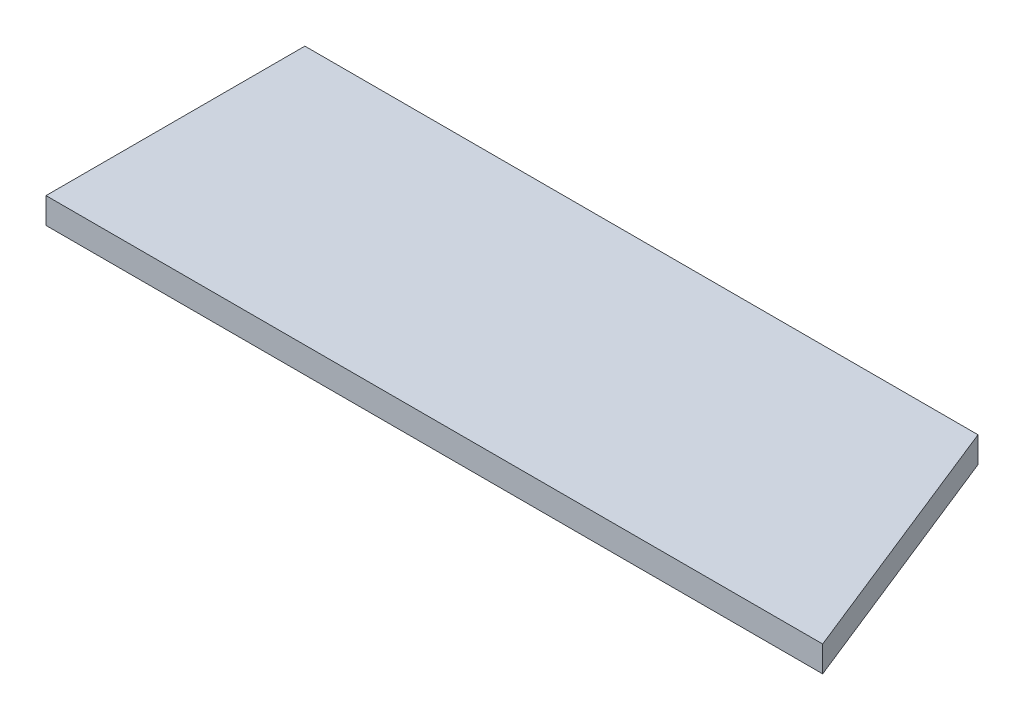
from build123d import *

# Parameters (mm, degrees)
EXTRUDE_1_DEPTH = 5


with BuildPart() as part:
    # Эскиз1 → Бобышка-Вытянуть1 (new body)
    with BuildSketch(Plane(origin=(0, 0, 0), x_dir=(1, 0, 0), z_dir=(0, 1, 0))):
        Polygon((0, 0), (150, 0), (130, 50), (0, 50), align=None)
    extrude(amount=EXTRUDE_1_DEPTH)


solid = part.part
